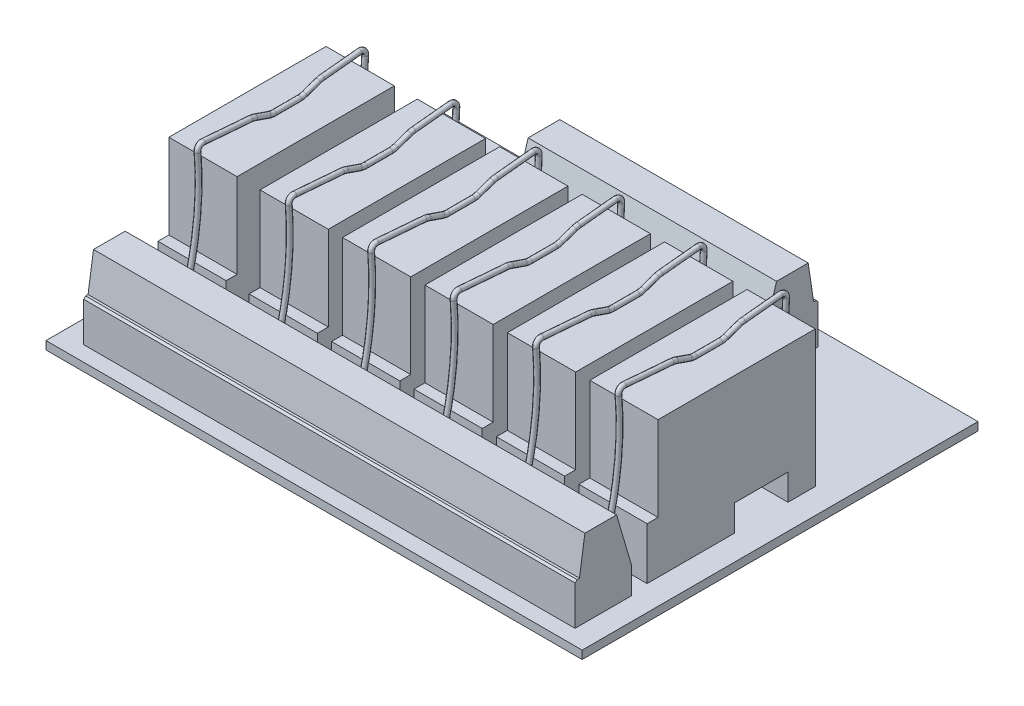
from build123d import *

# Parameters (mm, degrees)
SKETCH_2_W               = 98.2
SKETCH_2_H               = 72.5
EXTRUDE_1_DEPTH          = 1.5
SKETCH_3_W               = 12.5
SKETCH_3_H               = 28.8
EXTRUDE_2_DEPTH          = 25
SKETCH_3_3_W             = 12.5
SKETCH_3_3_H             = 2
EXTRUDE_3_DEPTH          = 9.5
CUT_EXTRUDE_1_DEPTH      = 67.536625253
CUT_EXTRUDE_1_DEPTH_BACK = 67.536625253
SKETCH_4_W               = 9.8
SKETCH_4_H               = 4.8
SKETCH_6_R               = 0.45
PATTERN_LINEAR_1_COUNT   = 2
PATTERN_LINEAR_1_PITCH   = 16.7
PATTERN_LINEAR_2_COUNT   = 5
PATTERN_LINEAR_2_PITCH   = 15.1
EXTRUDE_4_DEPTH          = 45
EXTRUDE_START            = -22.9
EXTRUDE_5_DEPTH          = 45.5


with BuildPart() as part:
    # 草圖2 → 填料-伸長1 (new body)
    with BuildSketch(Plane(origin=(0, 0, 0), x_dir=(1, 0, 0), z_dir=(0, 1, 0))):
        Rectangle(SKETCH_2_W, SKETCH_2_H)
    extrude(amount=EXTRUDE_1_DEPTH)

    # 草圖3 → 填料-伸長2 (add)
    with BuildSketch(Plane(origin=(0, 1.5, 0), x_dir=(1, 0, 0), z_dir=(0, 1, 0))):
        with Locations((-38.85, -3.35)):
            Rectangle(SKETCH_3_W, SKETCH_3_H)
        with Locations((-22.15, -3.35)):
            Rectangle(SKETCH_3_W, SKETCH_3_H)
        with Locations((-7.05, -3.35)):
            Rectangle(SKETCH_3_W, SKETCH_3_H)
        with Locations((8.05, -3.35)):
            Rectangle(SKETCH_3_W, SKETCH_3_H)
        with Locations((23.15, -3.35)):
            Rectangle(SKETCH_3_W, SKETCH_3_H)
        with Locations((38.25, -3.35)):
            Rectangle(SKETCH_3_W, SKETCH_3_H)
    extrude(amount=EXTRUDE_2_DEPTH)

    # 草圖3<3> → 填料-伸長3 (add)
    with BuildSketch(Plane(origin=(0, 1.5, 0), x_dir=(1, 0, 0), z_dir=(0, 1, 0))):
        with Locations((-38.85, -18.75)):
            Rectangle(SKETCH_3_3_W, SKETCH_3_3_H)
        with Locations((-22.15, -18.75)):
            Rectangle(SKETCH_3_3_W, SKETCH_3_3_H)
        with Locations((-7.05, -18.75)):
            Rectangle(SKETCH_3_3_W, SKETCH_3_3_H)
        with Locations((8.05, -18.75)):
            Rectangle(SKETCH_3_3_W, SKETCH_3_3_H)
        with Locations((23.15, -18.75)):
            Rectangle(SKETCH_3_3_W, SKETCH_3_3_H)
        with Locations((38.25, -18.75)):
            Rectangle(SKETCH_3_3_W, SKETCH_3_3_H)
    extrude(amount=EXTRUDE_3_DEPTH)

    # 草圖4 → 除料-伸長1 (cut, two sides: drawn at the far end of the back side and taken through both)
    with BuildSketch(Plane(origin=(0, 0, 0), x_dir=(0, 0, -1), z_dir=(1, 0, 0)).offset(-CUT_EXTRUDE_1_DEPTH_BACK)):
        with Locations((1.15, 3.9)):
            Rectangle(SKETCH_4_W, SKETCH_4_H)
    extrude(amount=CUT_EXTRUDE_1_DEPTH + CUT_EXTRUDE_1_DEPTH_BACK, mode=Mode.SUBTRACT)

    # 草圖7 → 填料-伸長4 (add, symmetric)
    with BuildSketch(Plane(origin=(0, 0, 0), x_dir=(0, 0, -1), z_dir=(1, 0, 0))):
        Polygon((-33.45, 8.7), (-33.45, 1.5), (-23.15, 1.5), (-23.15, 6.5), (-25.85, 15.7), (-31.65, 15.7), (-32.65, 9.053553391), (-33.096446609, 9.053553391), align=None)
    extrude(amount=EXTRUDE_4_DEPTH, both=True)

    # 草圖7<3> → 填料-伸長5 (add)
    with BuildSketch(Plane(origin=(0, 0, 0), x_dir=(0, 0, -1), z_dir=(1, 0, 0)).offset(EXTRUDE_START)):
        Polygon((25.85, 15.7), (23.15, 6.5), (23.15, 1.5), (33.45, 1.5), (33.45, 8.7), (33.096446609, 9.053553391), (32.65, 9.053553391), (31.65, 15.7), align=None)
    extrude(amount=EXTRUDE_5_DEPTH)


with BuildPart() as body_2:
    # 掃出1: sweep along a path in 草圖5
    with BuildLine(Plane.ZY.offset(38.85)) as sweep_1_path:
        Line((-9.335647868, 8.4), (-11.335647868, 8.4))
        ThreePointArc((-11.335647868, 8.4), (-11.708191541, 8.559457694), (-11.85, 8.93907053))
        ThreePointArc((-11.85, 8.93907053), (-11.652527234, 18.420840437), (-11.95, 27.9))
        ThreePointArc((-11.95, 27.9), (-11.658075196, 28.641396833), (-10.904408321, 28.9))
        Line((-10.904408321, 28.9), (-4.067987021, 28.2))
        ThreePointArc((-4.067987021, 28.2), (-3.704335476, 28.141180793), (-3.35, 28.040440951))
        Line((-3.35, 28.040440951), (-0.85, 27.169247637))
        ThreePointArc((-0.85, 27.169247637), (-0.35711063, 27.042610649), (0.15, 27))
        Line((0.15, 27), (4.75, 27))
        ThreePointArc((4.75, 27), (5.25711063, 27.042610649), (5.75, 27.169247637))
        Line((5.75, 27.169247637), (8.25, 28.040440951))
        ThreePointArc((8.25, 28.040440951), (8.623664046, 28.144441761), (9.007531563, 28.2))
        Line((9.007531563, 28.2), (17.75271248, 28.9))
        ThreePointArc((17.75271248, 28.9), (18.482675951, 28.630692261), (18.75, 27.9))
        ThreePointArc((18.75, 27.9), (18.734660538, 18.408121161), (20.25, 9.037969321))
        ThreePointArc((20.25, 9.037969321), (20.15527918, 8.597286661), (19.75, 8.4))
        Line((19.75, 8.4), (17.75, 8.4))
    # 草圖6 → 掃出1 (sweep)
    with BuildSketch(Plane.XY.offset(17.75)):
        with Locations((-38.85, 8.4)):
            Circle(SKETCH_6_R)
    sweep(path=sweep_1_path.line)


with BuildPart() as pattern_linear_1_1:
    # 直線複製排列1: pattern copy
    add(body_2.part.moved(Location(Vector(1, 0, 0) * (1 * PATTERN_LINEAR_1_PITCH))))


with BuildPart() as pattern_linear_2_1:
    # 直線複製排列2: pattern copy
    add(pattern_linear_1_1.part.moved(Location(Vector(1, 0, 0) * (1 * PATTERN_LINEAR_2_PITCH))))


with BuildPart() as pattern_linear_2_2:
    # 直線複製排列2: pattern copy
    add(pattern_linear_1_1.part.moved(Location(Vector(1, 0, 0) * (2 * PATTERN_LINEAR_2_PITCH))))


with BuildPart() as pattern_linear_2_3:
    # 直線複製排列2: pattern copy
    add(pattern_linear_1_1.part.moved(Location(Vector(1, 0, 0) * (3 * PATTERN_LINEAR_2_PITCH))))


with BuildPart() as pattern_linear_2_4:
    # 直線複製排列2: pattern copy
    add(pattern_linear_1_1.part.moved(Location(Vector(1, 0, 0) * (4 * PATTERN_LINEAR_2_PITCH))))


solid = Compound([part.part, body_2.part, pattern_linear_1_1.part, pattern_linear_2_1.part, pattern_linear_2_2.part, pattern_linear_2_3.part, pattern_linear_2_4.part])
